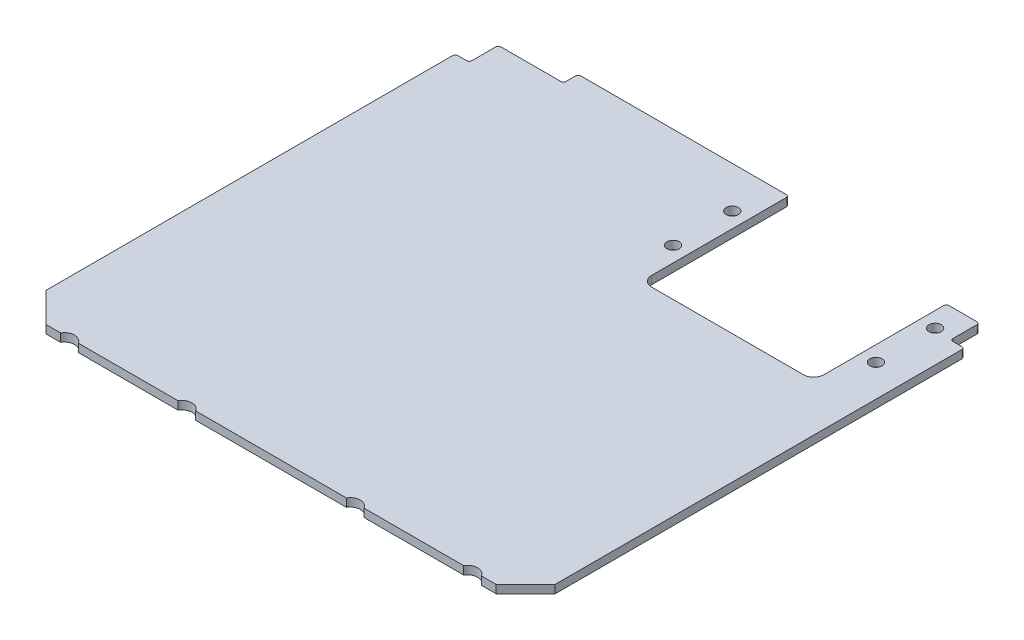
from build123d import *

# Parameters (mm, degrees)
GENERICCARDPCBDEFINITION_START = -0.8
GENERICCARDPCBDEFINITION_DEPTH = 1.6
SKETCH7_R                      = 1.2
CUT_EXTRUDE1_DEPTH             = 71.516735602
FILLET1_R                      = 0.5


# Read off the part's stored shape, not the designer's step: GenericCardPCBDefinition
with BuildPart() as part:
    # GenericCardPCBDefinition outline → GenericCardPCBDefinition (new body)
    with BuildSketch(Plane(origin=(0, 0, 0), x_dir=(1, 0, 0), z_dir=(0, 1, 0)).offset(GENERICCARDPCBDEFINITION_START)):
        with BuildLine():
            Line((-49.9, -39), (-44.1, -44.8))
            Line((-44.1, -44.8), (-41.232050808, -44.8))
            ThreePointArc((-41.232050808, -44.8), (-39.5, -43.8), (-37.767949192, -44.8))
            Line((-37.767949192, -44.8), (-18.232050808, -44.8))
            ThreePointArc((-18.232050808, -44.8), (-16.5, -43.8), (-14.767949192, -44.8))
            Line((-14.767949192, -44.8), (14.767949192, -44.8))
            ThreePointArc((14.767949192, -44.8), (16.5, -43.8), (18.232050808, -44.8))
            Line((18.232050808, -44.8), (37.767949192, -44.8))
            ThreePointArc((37.767949192, -44.8), (39.5, -43.8), (41.232050808, -44.8))
            Line((41.232050808, -44.8), (44.1, -44.8))
            Line((44.1, -44.8), (49.9, -39))
            Line((49.9, -39), (49.9, 40.7))
            ThreePointArc((49.9, 40.7), (49.753553391, 41.053553391), (49.4, 41.2))
            Line((49.4, 41.2), (47.65, 41.2))
            ThreePointArc((47.65, 41.2), (47.296446609, 41.346446609), (47.15, 41.7))
            Line((47.15, 41.7), (47.15, 46.4))
            ThreePointArc((47.15, 46.4), (47.003553391, 46.753553391), (46.65, 46.9))
            Line((46.65, 46.9), (34.9, 46.9))
            ThreePointArc((34.9, 46.9), (34.546446609, 47.046446609), (34.4, 47.4))
            Line((34.4, 47.4), (34.4, 49.3))
            ThreePointArc((34.4, 49.3), (34.253553391, 49.653553391), (33.9, 49.8))
            Line((33.9, 49.8), (-33.9, 49.8))
            ThreePointArc((-33.9, 49.8), (-34.253553391, 49.653553391), (-34.4, 49.3))
            Line((-34.4, 49.3), (-34.4, 47.4))
            ThreePointArc((-34.4, 47.4), (-34.546446609, 47.046446609), (-34.9, 46.9))
            Line((-34.9, 46.9), (-46.65, 46.9))
            ThreePointArc((-46.65, 46.9), (-47.003553391, 46.753553391), (-47.15, 46.4))
            Line((-47.15, 46.4), (-47.15, 41.7))
            ThreePointArc((-47.15, 41.7), (-47.296446609, 41.346446609), (-47.65, 41.2))
            Line((-47.65, 41.2), (-49.4, 41.2))
            ThreePointArc((-49.4, 41.2), (-49.753553391, 41.053553391), (-49.9, 40.7))
            Line((-49.9, 40.7), (-49.9, -39))
        make_face()
    extrude(amount=GENERICCARDPCBDEFINITION_DEPTH)

    # Sketch7 → Cut-Extrude1 (cut, through all)
    with BuildSketch(Plane.XZ.offset(0.8)):
        with Locations(Location((3.9, -41.7, 0), (0, 0, 270))):
            Circle(SKETCH7_R)
        with Locations(Location((3.9, -30.1, 0), (0, 0, 270))):
            Circle(SKETCH7_R)
        with Locations(Location((43.65, -41.7, 0), (0, 0, 270))):
            Circle(SKETCH7_R)
        with Locations(Location((43.65, -30.1, 0), (0, 0, 270))):
            Circle(SKETCH7_R)
        with BuildLine():
            Line((38.65, -20.9), (8.9, -20.9))
            ThreePointArc((8.9, -20.9), (7.485786438, -21.485786438), (6.9, -22.9))
            Line((6.9, -22.9), (6.9, -49.8))
            Line((6.9, -49.8), (40.65, -49.8))
            Line((40.65, -49.8), (40.65, -22.9))
            ThreePointArc((40.65, -22.9), (40.064213562, -21.485786438), (38.65, -20.9))
        make_face()
    extrude(amount=-CUT_EXTRUDE1_DEPTH, mode=Mode.SUBTRACT)

    # Fillet1
    fillet1_edges = [part.edges().sort_by_distance(p)[0] for p in [
        (40.65, 0, -46.9),
        (6.9, 0, -49.8),
    ]]
    fillet(fillet1_edges, radius=FILLET1_R)


solid = part.part
